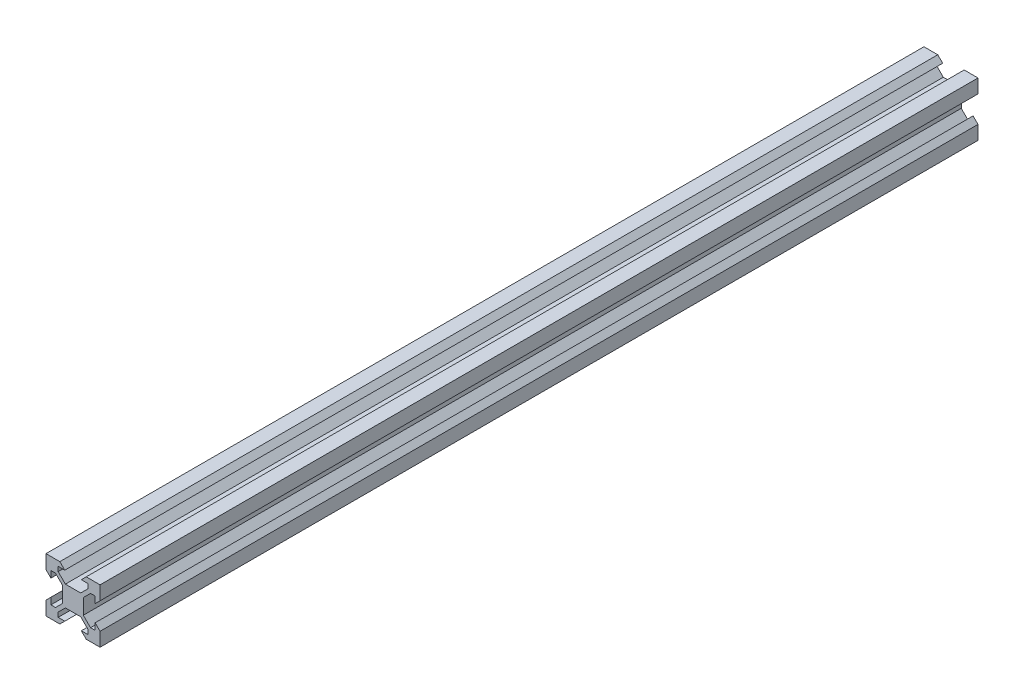
from build123d import *

# Parameters (mm, degrees)
SKETCH1_W           = 20
SKETCH1_H           = 20
BOSS_EXTRUDE1_DEPTH = 324.8
CUT_EXTRUDE1_DEPTH  = 327.029201146


with BuildPart() as part:
    # Sketch1 → Boss-Extrude1 (new body)
    with BuildSketch(Plane.XY):
        with Locations((10, 10)):
            Rectangle(SKETCH1_W, SKETCH1_H)
    extrude(amount=BOSS_EXTRUDE1_DEPTH)

    # Sketch2 → Cut-Extrude1 (cut, through all)
    with BuildSketch(Plane.XY.offset(324.8)):
        Polygon((4.5, 18.18), (6.94, 18.18), (5.12, 20), (14.88, 20), (13.06, 18.18), (15.5, 18.18), (15.5, 16.475807358), (12.834192642, 13.81), (7.165807358, 13.81), (4.5, 16.475807358), align=None)
        Polygon((14.88, 0), (13.06, 1.82), (15.5, 1.82), (15.5, 3.524192642), (12.834192642, 6.19), (7.165807358, 6.19), (4.5, 3.524192642), (4.5, 1.82), (6.94, 1.82), (5.12, 0), align=None)
        Polygon((1.82, 4.5), (1.82, 6.94), (0, 5.12), (0, 14.88), (1.82, 13.06), (1.82, 15.5), (3.524192642, 15.5), (6.19, 12.834192642), (6.19, 7.165807358), (3.524192642, 4.5), align=None)
        Polygon((20, 14.88), (18.18, 13.06), (18.18, 15.5), (16.475807358, 15.5), (13.81, 12.834192642), (13.81, 7.165807358), (16.475807358, 4.5), (18.18, 4.5), (18.18, 6.94), (20, 5.12), align=None)
    extrude(amount=-CUT_EXTRUDE1_DEPTH, mode=Mode.SUBTRACT)


solid = part.part
